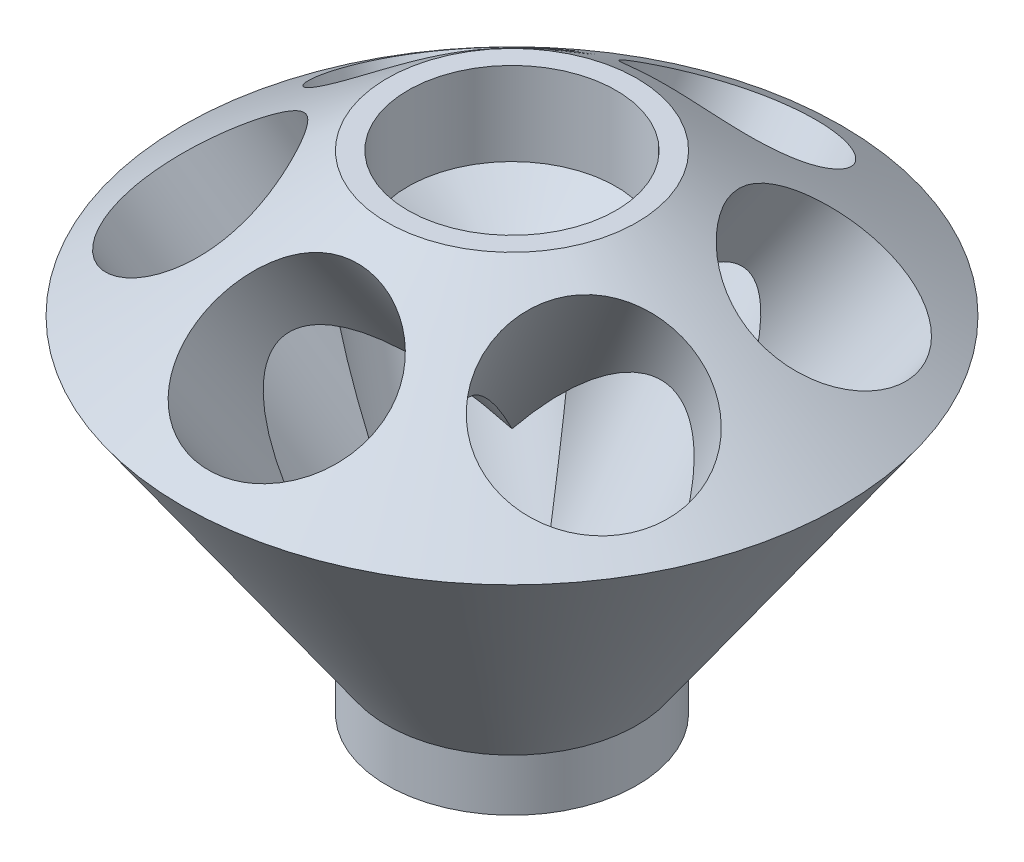
from build123d import *
from OCP.BRepAlgoAPI import BRepAlgoAPI_Cut
from OCP.TopTools import TopTools_ListOfShape

# Parameters (mm, degrees)
F_7_16_0_4375_DIAMETER_HOLE4_D     = 11.1125
F_7_16_0_4375_DIAMETER_HOLE4_DEPTH = 6.35
F_7_16_0_4375_DIAMETER_HOLE4_TIP   = 3.338531814
CIRPATTERN3_COUNT                  = 6
F_1_2_0_5_DIAMETER_HOLE1_D         = 12.7
F_1_2_0_5_DIAMETER_HOLE1_DEPTH     = 5.08
F_1_2_0_5_DIAMETER_HOLE1_TIP       = 3.815464931


with BuildPart() as part:
    # Sketch1 → Revolve1 (revolve)
    with BuildSketch(Plane.XY):
        Polygon((0, 0), (0, 26.570129165), (7.62, 26.570129165), (20.103877155, 17.828824275), (7.62, 0), (7.62, -3.175), (0, -3.175), align=None)
    revolve(axis=Axis((0, 0, 0), (0, 1, 0)))

    # 7/16 (0.4375) Diameter Hole4
    with Locations(Plane(origin=(0.774073223, -3.175, 1.453774394), x_dir=(-1, 0, 0), z_dir=(0, -1, 0))):
        with Locations((0.774073223, 1.453774394)):
            Hole(F_7_16_0_4375_DIAMETER_HOLE4_D / 2, depth=F_7_16_0_4375_DIAMETER_HOLE4_DEPTH)
            with Locations((0, 0, -(F_7_16_0_4375_DIAMETER_HOLE4_DEPTH + F_7_16_0_4375_DIAMETER_HOLE4_TIP / 2))):  # 118° drill point
                Cone(0, F_7_16_0_4375_DIAMETER_HOLE4_D / 2, F_7_16_0_4375_DIAMETER_HOLE4_TIP, mode=Mode.SUBTRACT)


with BuildPart() as f_7_16_0_4375_diameter_hole5_tool:
    # Sketch14 → 7/16 (0.4375) Diameter Hole5 (revolve)
    with BuildSketch(Plane(origin=(0, 22.123811298, -13.97), x_dir=(0, 0.5735764363510476, 0.8191520442889908), z_dir=(1, 0, 0))):
        Polygon((0, 0), (0, 28.738531814), (5.55625, 25.4), (5.55625, 0), align=None)
    f_7_16_0_4375_diameter_hole5 = revolve(axis=Axis((0, 27.325426779, -17.612210371), (0, -0.8191520442889908, 0.5735764363510476)))


with BuildPart() as part_1:
    add(part.part)

    # 7/16 (0.4375) Diameter Hole5: cut by f_7_16_0_4375_diameter_hole5_tool, with a tolerance
    f_7_16_0_4375_diameter_hole5_stock = TopTools_ListOfShape()
    f_7_16_0_4375_diameter_hole5_stock.Append(part_1.part.wrapped)
    f_7_16_0_4375_diameter_hole5_tools = TopTools_ListOfShape()
    f_7_16_0_4375_diameter_hole5_tools.Append(f_7_16_0_4375_diameter_hole5_tool.part.wrapped)
    f_7_16_0_4375_diameter_hole5_cut = BRepAlgoAPI_Cut()
    f_7_16_0_4375_diameter_hole5_cut.SetArguments(f_7_16_0_4375_diameter_hole5_stock)
    f_7_16_0_4375_diameter_hole5_cut.SetTools(f_7_16_0_4375_diameter_hole5_tools)
    f_7_16_0_4375_diameter_hole5_cut.SetFuzzyValue(0.00001)
    f_7_16_0_4375_diameter_hole5_cut.Build()
    add(Compound.cast(f_7_16_0_4375_diameter_hole5_cut.Shape()).solids(), mode=Mode.REPLACE)

    # CirPattern3: 7/16 (0.4375) Diameter Hole5 ×6 about axis
    cirpattern3_axis = Axis((0, 26.570129165, 0), (0, -1, 0))
    for i in range(1, CIRPATTERN3_COUNT):
        add(f_7_16_0_4375_diameter_hole5.rotate(cirpattern3_axis, i * 360 / CIRPATTERN3_COUNT), mode=Mode.SUBTRACT)

    # 1/2 (0.5) Diameter Hole1
    with Locations(Plane(origin=(0, 26.570129165, 0), x_dir=(1, 0, 0), z_dir=(0, 1, 0))):
        with Locations((0, 0)):
            Hole(F_1_2_0_5_DIAMETER_HOLE1_D / 2, depth=F_1_2_0_5_DIAMETER_HOLE1_DEPTH)
            with Locations((0, 0, -(F_1_2_0_5_DIAMETER_HOLE1_DEPTH + F_1_2_0_5_DIAMETER_HOLE1_TIP / 2))):  # 118° drill point
                Cone(0, F_1_2_0_5_DIAMETER_HOLE1_D / 2, F_1_2_0_5_DIAMETER_HOLE1_TIP, mode=Mode.SUBTRACT)


solid = part_1.part
